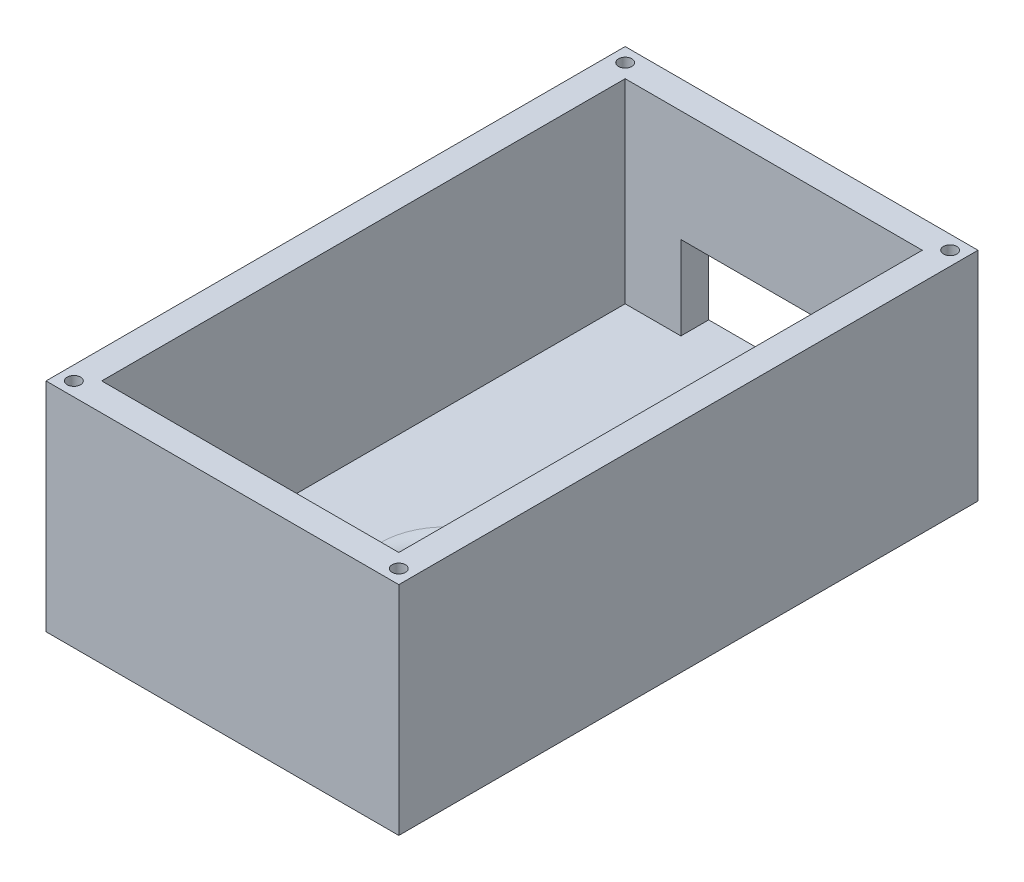
from build123d import *

# Parameters (mm, degrees)
SCHIZZO1_W                   = 63.34
SCHIZZO1_H                   = 103.98
ESTRUSIONE_ESTRUSIONE1_DEPTH = 4
SCHIZZO2_W                   = 63.34
SCHIZZO2_H                   = 103.98
SCHIZZO2_W_2                 = 53.34
SCHIZZO2_H_2                 = 93.98
ESTRUSIONE_ESTRUSIONE2_DEPTH = 35
FORO_PER_VITE_M2_1_D         = 2.4
SCHIZZO5_W                   = 33.34
SCHIZZO5_H                   = 15
TAGLIO_ESTRUSIONE1_DEPTH     = 126.106755432
TAGLIO_ESTRUSIONE2_DEPTH     = 132.87260726
RACCORDO1_R                  = 4


with BuildPart() as part:
    # Schizzo1 → Estrusione-Estrusione1 (new body)
    with BuildSketch(Plane(origin=(0, 0, 0), x_dir=(1, 0, 0), z_dir=(0, 1, 0))):
        with Locations((34.160538922, 55.414491018)):
            Rectangle(SCHIZZO1_W, SCHIZZO1_H)
    extrude(amount=ESTRUSIONE_ESTRUSIONE1_DEPTH)

    # Schizzo2 → Estrusione-Estrusione2 (add)
    with BuildSketch(Plane(origin=(0, 4, 0), x_dir=(1, 0, 0), z_dir=(0, 1, 0))):
        with Locations((34.160538922, 55.414491018)):
            Rectangle(SCHIZZO2_W, SCHIZZO2_H)
        with Locations((34.160538922, 55.414491018)):
            Rectangle(SCHIZZO2_W_2, SCHIZZO2_H_2, mode=Mode.SUBTRACT)
    extrude(amount=ESTRUSIONE_ESTRUSIONE2_DEPTH)

    # Foro per Vite M2-1 (through all)
    with Locations(Plane(origin=(0, 39, 0), x_dir=(1, 0, 0), z_dir=(0, 1, 0))):
        with Locations((4.990538922, 104.904491018), (63.330538922, 104.904491018), (63.330538922, 5.924491018), (4.990538922, 5.924491018)):
            Hole(FORO_PER_VITE_M2_1_D / 2)

    # Schizzo5 → Taglio-Estrusione1 (cut, through all)
    with BuildSketch(Plane.XY.offset(-102.404491018)):
        with Locations((34.160538922, 11.5)):
            Rectangle(SCHIZZO5_W, SCHIZZO5_H)
    extrude(amount=-TAGLIO_ESTRUSIONE1_DEPTH, mode=Mode.SUBTRACT)

    # Schizzo6 → Taglio-Estrusione2 (cut, through all)
    with BuildSketch(Plane(origin=(0, 0, 0), x_dir=(-1, 0, 0), z_dir=(0, -1, 0))):
        with BuildLine():
            Line((-31.160538922, 33.819804662), (-31.160538922, 20.424491018))
            ThreePointArc((-31.160538922, 20.424491018), (-31.74632536, 19.010277456), (-33.160538922, 18.424491018))
            Line((-33.160538922, 18.424491018), (-35.160538922, 18.424491018))
            ThreePointArc((-35.160538922, 18.424491018), (-36.574752485, 19.010277456), (-37.160538922, 20.424491018))
            Line((-37.160538922, 20.424491018), (-37.160538922, 33.819804662))
            ThreePointArc((-37.160538922, 33.819804662), (-37.632846353, 35.941125005), (-38.960538922, 37.661679204))
            ThreePointArc((-38.960538922, 37.661679204), (-34.160538922, 50.924491018), (-29.360538922, 37.661679204))
            ThreePointArc((-29.360538922, 37.661679204), (-30.688231491, 35.941125005), (-31.160538922, 33.819804662))
        make_face()
    extrude(amount=-TAGLIO_ESTRUSIONE2_DEPTH, mode=Mode.SUBTRACT)

    # Raccordo1
    raccordo1_edges = [part.edges().sort_by_distance(p)[0] for p in [
        (30.688231491, 4, -35.941125005),
        (31.160538922, 4, -27.12214784),
        (31.74632536, 4, -19.010277456),
        (34.160538922, 4, -18.424491018),
        (36.574752485, 4, -19.010277456),
        (37.160538922, 4, -27.12214784),
        (37.632846353, 4, -35.941125005),
        (34.160538922, 4, -50.924491018),
    ]]
    fillet(raccordo1_edges, radius=RACCORDO1_R - 0.0001)  # a hair under: the kernel refuses the full size


solid = part.part
